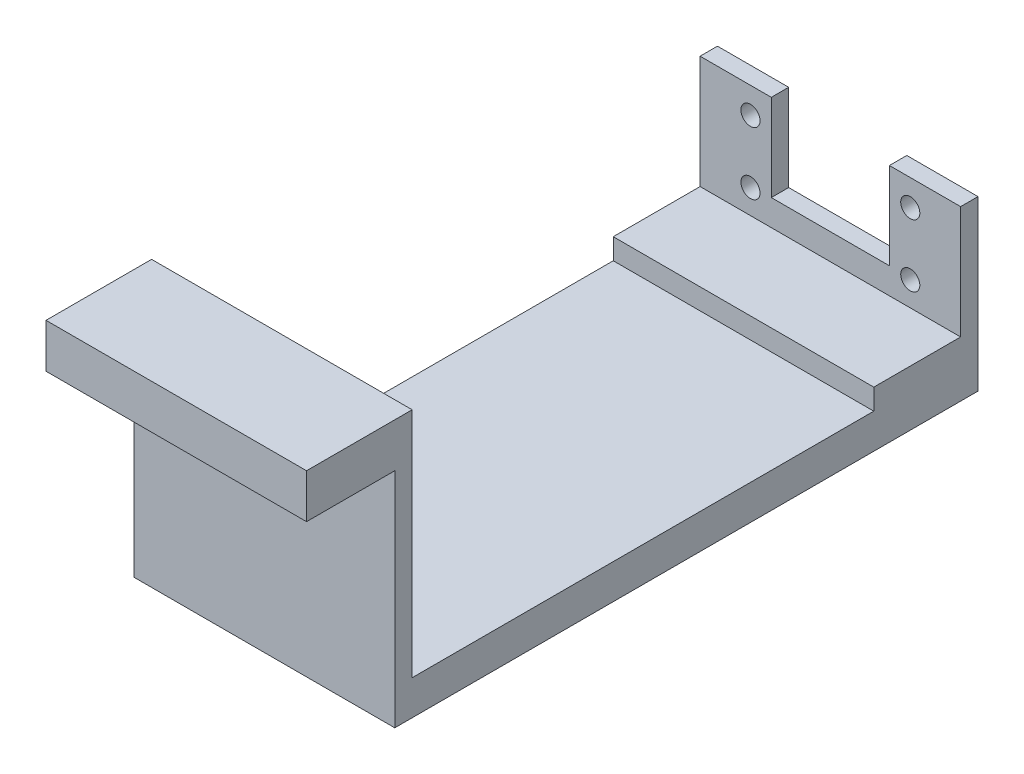
from build123d import *

# Parameters (mm, degrees)
SKETCH1_R                = 2.75
BOSS_EXTRUDE1_DEPTH      = 5
BOSS_EXTRUDE2_DEPTH      = 25
BOSS_EXTRUDE2_DEPTH_BACK = 5
SKETCH2_W                = 75
SKETCH2_H                = 6
SKETCH3_W                = 75
SKETCH3_H                = 10
BOSS_EXTRUDE3_DEPTH      = 167.8942
SKETCH4_W                = 75
SKETCH4_H                = 5
BOSS_EXTRUDE4_DEPTH      = 66.8
SKETCH5_W                = 75
SKETCH5_H                = 12.7
BOSS_EXTRUDE5_DEPTH      = 25.4


with BuildPart() as part:
    # Sketch1 → Boss-Extrude1 (new body)
    with BuildSketch(Plane.XY):
        Polygon((20.5, 7.5), (20.5, 32.5), (0, 32.5), (0, 0), (75, 0), (75, 32.5), (54.5, 32.5), (54.5, 7.5), align=None)
        with Locations((14.5, 7)):
            Circle(SKETCH1_R, mode=Mode.SUBTRACT)
        with Locations((14.5, 25)):
            Circle(SKETCH1_R, mode=Mode.SUBTRACT)
        with Locations((60.5, 25)):
            Circle(SKETCH1_R, mode=Mode.SUBTRACT)
        with Locations((60.5, 7)):
            Circle(SKETCH1_R, mode=Mode.SUBTRACT)
    extrude(amount=BOSS_EXTRUDE1_DEPTH)

    # Sketch2 → Boss-Extrude2 (add, two sides: drawn at the far end of the back side and taken through both)
    with BuildSketch(Plane.XY.offset(5).offset(-BOSS_EXTRUDE2_DEPTH_BACK)):
        with Locations((37.5, -3)):
            Rectangle(SKETCH2_W, SKETCH2_H)
    extrude(amount=BOSS_EXTRUDE2_DEPTH + BOSS_EXTRUDE2_DEPTH_BACK)

    # Sketch3 → Boss-Extrude3 (add)
    with BuildSketch(Plane(origin=(0, 0, 0), x_dir=(-1, 0, 0), z_dir=(0, 0, -1))):
        with Locations((-37.5, -11)):
            Rectangle(SKETCH3_W, SKETCH3_H)
    extrude(amount=-BOSS_EXTRUDE3_DEPTH)

    # Sketch4 → Boss-Extrude4 (add)
    with BuildSketch(Plane(origin=(0, -6, 0), x_dir=(1, 0, 0), z_dir=(0, 1, 0))):
        with Locations((37.5, -165.3942)):
            Rectangle(SKETCH4_W, SKETCH4_H)
    extrude(amount=BOSS_EXTRUDE4_DEPTH)

    # Sketch5 → Boss-Extrude5 (add)
    with BuildSketch(Plane.XY.offset(167.8942)):
        with Locations((37.5, 54.45)):
            Rectangle(SKETCH5_W, SKETCH5_H)
    extrude(amount=BOSS_EXTRUDE5_DEPTH)


solid = part.part
